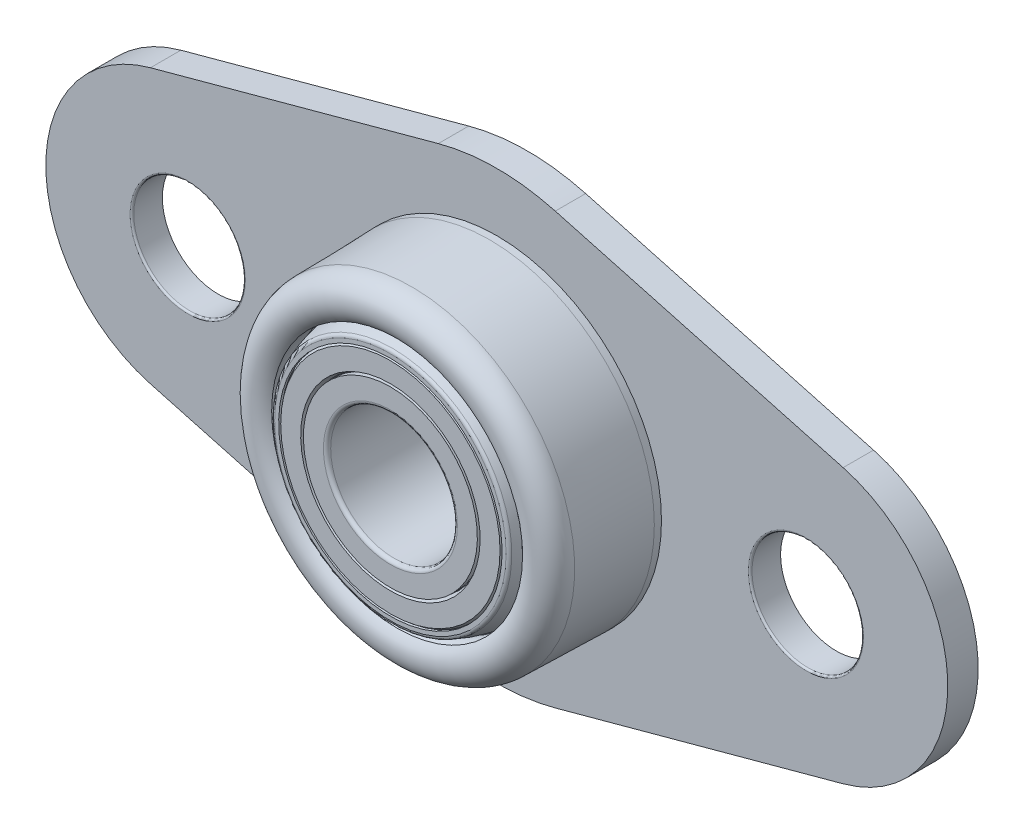
from build123d import *

# Parameters (mm, degrees)
BOSS_EXTRUDE1_START = -3.429
SKETCH4_R           = 2.794
SKETCH4_R_2         = 8.255
BOSS_EXTRUDE1_DEPTH = 1.524
SKETCH5_R           = 0.762381
FILLET1_R           = 0.18288
BOSS_EXTRUDE2_DEPTH = 0.5080254
CIRPATTERN1_COUNT   = 54
FILLET2_R           = 0.508
CHAMFER1_SIZE       = 0.0635
FILLET3_R           = 0.09144
INDENT1_START       = -3.429
INDENT1_DEPTH       = 0.5080254


# Read off the part's stored shape, not the designer's step: Indent1
with BuildPart() as part:
    # Sketch4 → Boss-Extrude1 (new body)
    with BuildSketch(Plane.XY.offset(BOSS_EXTRUDE1_START)):
        with BuildLine():
            Line((-17.359442623, 6.862992629), (-2.931409836, 10.784702702))
            ThreePointArc((-2.931409836, 10.784702702), (0, 11.176), (2.931409836, 10.784702702))
            Line((2.931409836, 10.784702702), (17.359442623, 6.862992629))
            ThreePointArc((17.359442623, 6.862992629), (22.606, 0), (17.359442623, -6.862992629))
            Line((17.359442623, -6.862992629), (2.931409836, -10.784702702))
            ThreePointArc((2.931409836, -10.784702702), (0, -11.176), (-2.931409836, -10.784702702))
            Line((-2.931409836, -10.784702702), (-17.359442623, -6.862992629))
            ThreePointArc((-17.359442623, -6.862992629), (-22.606, 0), (-17.359442623, 6.862992629))
        make_face()
        with Locations(Location((15.494, 0, 0), (0, 0, 180))):
            Circle(SKETCH4_R, mode=Mode.SUBTRACT)
        with Locations(Location((-15.494, 0, 0), (0, 0, 180))):
            Circle(SKETCH4_R, mode=Mode.SUBTRACT)
        with Locations(Location((0, 0, 0), (0, 0, 180))):
            Circle(SKETCH4_R_2, mode=Mode.SUBTRACT)
    extrude(amount=BOSS_EXTRUDE1_DEPTH)

    # Fillet2
    fillet2_edges = [part.edges().sort_by_distance(p)[0] for p in [
        (8.255, 0, -3.429),
    ]]
    fillet(fillet2_edges, radius=FILLET2_R)

    # Fillet3
    fillet3_edges = [part.edges().sort_by_distance(p)[0] for p in [
        (18.288, 0, -1.905),
        (-12.7, 0, -1.905),
    ]]
    fillet(fillet3_edges, radius=FILLET3_R)

    # Indent1 outline → Indent1 (cut)
    with BuildSketch(Plane.XY.offset(INDENT1_START)):
        Polygon((0.518388604, 8.900388604), (0, 8.382), (-0.518388604, 8.900388604), (-0.973090807, 8.325323915), (-1.548155496, 8.780026117), (-1.933022229, 8.156062105), (-2.55698624, 8.540928838), (-2.866812842, 7.876503547), (-3.531238132, 8.186330149), (-3.761834729, 7.490428791), (-4.457736086, 7.721025388), (-4.605984255, 7.003058835), (-5.323950807, 7.151307004), (-5.387845745, 6.420984522), (-6.118168226, 6.48487946), (-6.096845864, 5.752077408), (-6.829647915, 5.730755047), (-6.723396602, 5.005383315), (-7.448768333, 4.899132002), (-7.259024935, 4.191), (-7.967156937, 4.001256602), (-7.696487408, 3.319940598), (-8.377803411, 3.04927107), (-8.029868092, 2.403984696), (-8.675154466, 2.056049378), (-8.254658586, 1.455519025), (-8.855188939, 1.035023145), (-8.367818983, 0.487369955), (-8.915472172, 0), (-8.367818983, -0.487369956), (-8.855188939, -1.035023146), (-8.254658586, -1.455519026), (-8.675154466, -2.056049378), (-8.029868092, -2.403984697), (-8.377803411, -3.04927107), (-7.696487408, -3.319940599), (-7.967156937, -4.001256602), (-7.259024934, -4.191), (-7.448768333, -4.899132003), (-6.723396601, -5.005383316), (-6.829647915, -5.730755047), (-6.096845863, -5.752077409), (-6.118168226, -6.48487946), (-5.387845744, -6.420984523), (-5.323950807, -7.151307004), (-4.605984254, -7.003058836), (-4.457736086, -7.721025388), (-3.761834728, -7.490428791), (-3.531238132, -8.186330149), (-2.866812841, -7.876503548), (-2.55698624, -8.540928838), (-1.933022228, -8.156062105), (-1.548155495, -8.780026117), (-0.973090806, -8.325323915), (-0.518388604, -8.900388604), (0, -8.382), (0.518388604, -8.900388604), (0.973090807, -8.325323915), (1.548155496, -8.780026117), (1.933022229, -8.156062105), (2.55698624, -8.540928838), (2.866812842, -7.876503547), (3.531238132, -8.186330149), (3.761834729, -7.490428791), (4.457736086, -7.721025388), (4.605984255, -7.003058835), (5.323950807, -7.151307004), (5.387845745, -6.420984522), (6.118168226, -6.48487946), (6.096845864, -5.752077408), (6.829647915, -5.730755047), (6.723396602, -5.005383315), (7.448768333, -4.899132002), (7.259024935, -4.191), (7.967156937, -4.001256602), (7.696487408, -3.319940598), (8.377803411, -3.04927107), (8.029868092, -2.403984696), (8.675154466, -2.056049378), (8.254658586, -1.455519025), (8.855188939, -1.035023145), (8.367818983, -0.487369955), (8.915472172, 0), (8.367818983, 0.487369956), (8.855188939, 1.035023146), (8.254658586, 1.455519026), (8.675154466, 2.056049378), (8.029868092, 2.403984697), (8.377803411, 3.04927107), (7.696487408, 3.319940599), (7.967156937, 4.001256602), (7.259024934, 4.191), (7.448768333, 4.899132003), (6.723396601, 5.005383316), (6.829647915, 5.730755047), (6.096845863, 5.752077409), (6.118168226, 6.48487946), (5.387845744, 6.420984523), (5.323950807, 7.151307004), (4.605984254, 7.003058836), (4.457736086, 7.721025388), (3.761834728, 7.490428791), (3.531238132, 8.186330149), (2.866812841, 7.876503548), (2.55698624, 8.540928838), (1.933022228, 8.156062105), (1.548155495, 8.780026117), (0.973090806, 8.325323915), align=None)
    extrude(amount=INDENT1_DEPTH, mode=Mode.SUBTRACT)


with BuildPart() as body_2:
    # Sketch5 → Revolve1 (revolve)
    with BuildSketch(Plane(origin=(0, 0, 0), x_dir=(0, 0, -1), z_dir=(1, 0, 0)), mode=Mode.PRIVATE) as revolve1_sk:
        with Locations((-2.3368, 7.077798261)):
            Circle(SKETCH5_R)
        with BuildLine():
            Line((3.429, 8.255), (1.54686, 8.255))
            Line((1.54686, 8.255), (-2.360626217, 8.169738347))
            ThreePointArc((-2.360626217, 8.169738347), (-3.354738995, 7.473653087), (-3.09207056, 6.288832342))
            Line((-3.09207056, 6.288832342), (-2.881560847, 6.508733657))
            ThreePointArc((-2.881560847, 6.508733657), (-2.823159589, 7.697518565), (-1.654561641, 7.471688761))
            Line((-1.654561641, 7.471688761), (-1.067037737, 6.454067508))
            Line((-1.067037737, 6.454067508), (1.5964, 6.454067508))
            Line((1.5964, 6.454067508), (1.5964, 6.5405))
            Line((1.5964, 6.5405), (2.4129492, 6.5405))
            Line((2.4129492, 6.5405), (2.4129492, 4.445))
            Line((2.4129492, 4.445), (3.429, 4.445))
            Line((3.429, 4.445), (3.429, 8.255))
        make_face()
        with BuildLine():
            Line((-3.429, 3.175), (1.571, 3.175))
            Line((1.571, 3.175), (1.571, 5.800070388))
            ThreePointArc((1.571, 5.800070388), (1.539534769, 5.902630916), (1.455966513, 5.969899552))
            ThreePointArc((1.455966513, 5.969899552), (-0.929, 6.428667508), (-3.313966513, 5.969899552))
            ThreePointArc((-3.313966513, 5.969899552), (-3.397534769, 5.902630916), (-3.429, 5.800070388))
            Line((-3.429, 5.800070388), (-3.429, 3.175))
        make_face()
    revolve(revolve1_sk.sketch.rotate(Axis((0, 0, -3.429), (0, 0, 1)), 90), axis=Axis((0, 0, -3.429), (0, 0, 1)))

    # Fillet1
    fillet1_edges = [body_2.edges().sort_by_distance(p)[0] for p in [
        (3.175, 0, 3.429),
        (3.175, 0, -1.571),
    ]]
    fillet(fillet1_edges, radius=FILLET1_R)

    # Sketch6 → Boss-Extrude2 (add)
    with BuildSketch(Plane(origin=(0, 0, -3.429), x_dir=(-1, 0, 0), z_dir=(0, 0, -1))):
        with BuildLine():
            Line((0.518388604, 8.900388604), (0.973090807, 8.325323915))
            Line((0.973090807, 8.325323915), (0.516033004, 4.4149445))
            ThreePointArc((0.516033004, 4.4149445), (0.258453765, 4.437479764), (0, 4.445))
            Line((0, 4.445), (0, 8.382))
            Line((0, 8.382), (0.518388604, 8.900388604))
        make_face()
    boss_extrude2 = extrude(amount=-BOSS_EXTRUDE2_DEPTH)

    # CirPattern1: Boss-Extrude2 ×54 about axis
    cirpattern1_axis = Axis((0, 0, 0), (0, 0, 1))
    for i in range(1, CIRPATTERN1_COUNT):
        add(boss_extrude2.rotate(cirpattern1_axis, i * 360 / CIRPATTERN1_COUNT))

    # Chamfer1
    chamfer1_edges = [body_2.edges().sort_by_distance(p)[0] for p in [
        (-4.443119543, 0.129281575, -3.429),
        (4.445, 0, -2.4129492),
    ]]
    chamfer(chamfer1_edges, length=CHAMFER1_SIZE)

    # Sketch7 → Cut-Revolve1 (revolve, cut)
    with BuildSketch(Plane(origin=(0, 0, 0), x_dir=(0, 0, -1), z_dir=(1, 0, 0))):
        Polygon((-3.429, 5.497347098), (-3.12198901, 5.674599976), (1.26398901, 5.674599976), (1.571, 5.497347098), (1.571, 5.599999976), (1.444, 5.599999976), (1.270794919, 5.699999976), (-3.128794919, 5.699999976), (-3.302, 5.599999976), (-3.429, 5.599999976), align=None)
        Polygon((-3.429, 4.497347098), (-3.12198901, 4.385604236), (-3.12198901, 4.334804236), (1.26398901, 4.334804236), (1.26398901, 4.385604236), (1.571, 4.497347098), (1.571, 4.360204236), (1.28938901, 4.360204236), (1.28938901, 4.309404236), (-3.14738901, 4.309404236), (-3.14738901, 4.360204236), (-3.429, 4.360204236), align=None)
    revolve(axis=Axis((0, 0, 0), (0, 0, 1)), mode=Mode.SUBTRACT)


solid = Compound([part.part, body_2.part])
